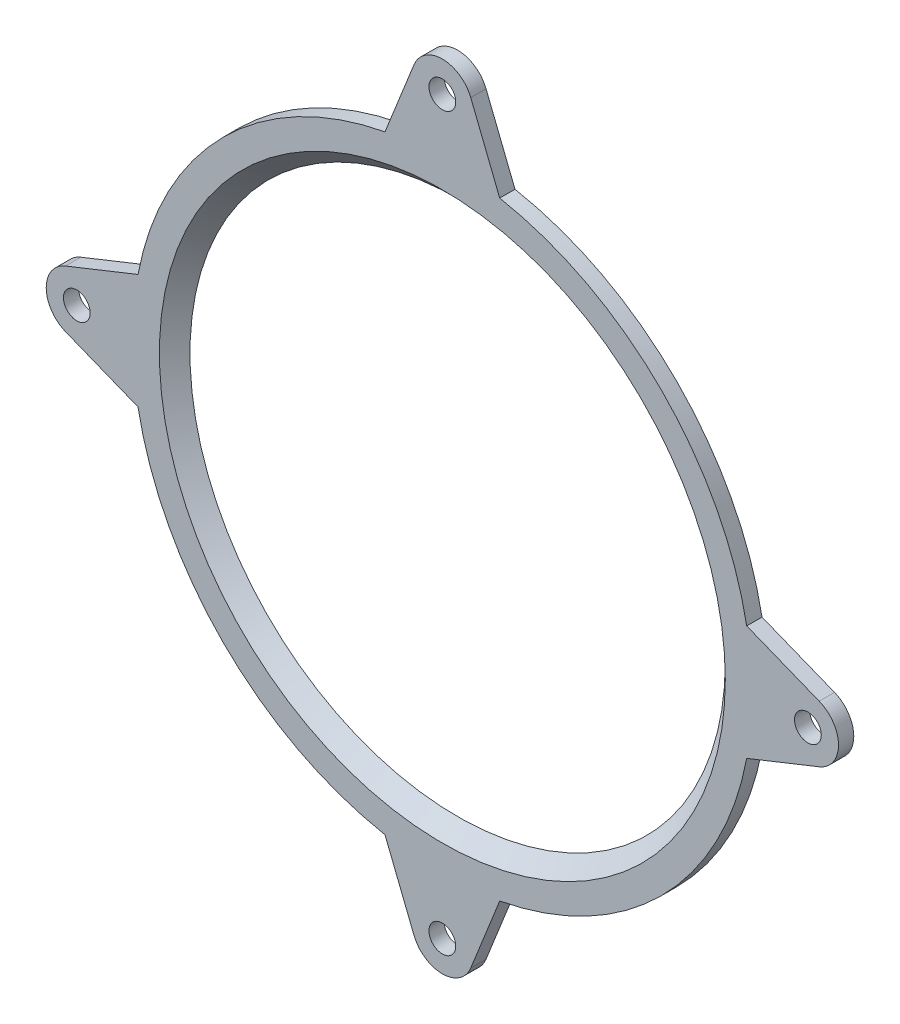
from build123d import *

# Parameters (mm, degrees)
SKETCH1_R           = 40.5
SKETCH1_R_2         = 35
BOSS_EXTRUDE1_DEPTH = 2
SKETCH2_R           = 1.75
BOSS_EXTRUDE2_DEPTH = 2
CIRPATTERN1_COUNT   = 4
CHAMFER1_SIZE       = 2


with BuildPart() as part:
    # Sketch1 → Boss-Extrude1 (new body)
    with BuildSketch(Plane.XY):
        Circle(SKETCH1_R)
        Circle(SKETCH1_R_2, mode=Mode.SUBTRACT)
    extrude(amount=BOSS_EXTRUDE1_DEPTH)

    # Sketch2 → Boss-Extrude2 (add)
    with BuildSketch(Plane.XY):
        with BuildLine():
            Line((7.5, 39.799497484), (3.715004122, 49.282313849))
            ThreePointArc((3.715004122, 49.282313849), (0, 51.799497484), (-3.715004122, 49.282313849))
            Line((-3.715004122, 49.282313849), (-7.5, 39.799497484))
            ThreePointArc((-7.5, 39.799497484), (0, 40.5), (7.5, 39.799497484))
        make_face()
        with Locations((0, 47.799497484)):
            Circle(SKETCH2_R, mode=Mode.SUBTRACT)
    boss_extrude2 = extrude(amount=BOSS_EXTRUDE2_DEPTH)

    # CirPattern1: Boss-Extrude2 ×4 about axis
    cirpattern1_axis = Axis((0, 0, 0), (0, 0, 1))
    for i in range(1, CIRPATTERN1_COUNT):
        add(boss_extrude2.rotate(cirpattern1_axis, i * 360 / CIRPATTERN1_COUNT))

    # Chamfer1
    chamfer1_edges = [part.edges().sort_by_distance(p)[0] for p in [
        (-35, 0, 2),
    ]]
    chamfer(chamfer1_edges, length=CHAMFER1_SIZE - 0.0001)  # a hair under: the kernel refuses the full size


solid = part.part
